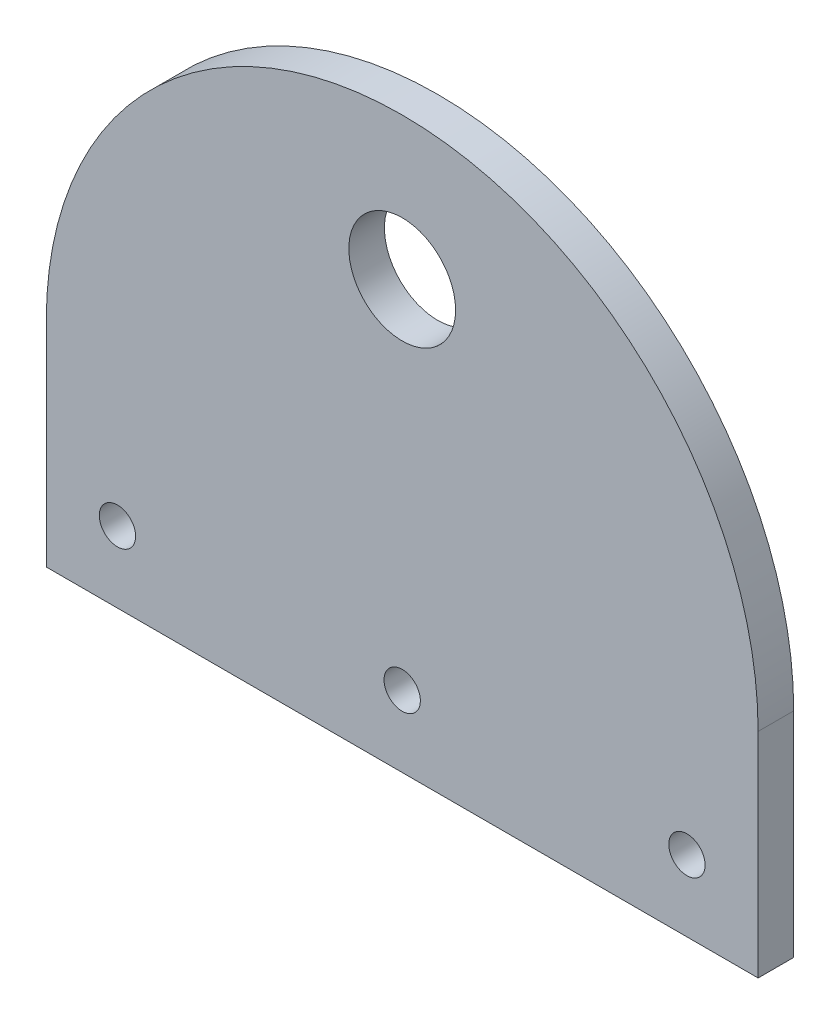
from build123d import *

# Parameters (mm, degrees)
SKETCH_1_R      = 7.5
SKETCH_1_R_2    = 2.55
EXTRUDE_1_DEPTH = 5


with BuildPart() as part:
    # ｽｹｯﾁ1 → ﾎﾞｽ - 押し出し1 (new body)
    with BuildSketch(Plane.XY):
        with BuildLine():
            Line((-50, -60), (50, -60))
            Line((50, -60), (50, -30))
            ThreePointArc((50, -30), (0, 20), (-50, -30))
            Line((-50, -30), (-50, -60))
        make_face()
        Circle(SKETCH_1_R, mode=Mode.SUBTRACT)
        with Locations((-40, -50)):
            Circle(SKETCH_1_R_2, mode=Mode.SUBTRACT)
        with Locations((0, -50)):
            Circle(SKETCH_1_R_2, mode=Mode.SUBTRACT)
        with Locations((40, -50)):
            Circle(SKETCH_1_R_2, mode=Mode.SUBTRACT)
    extrude(amount=EXTRUDE_1_DEPTH)


solid = part.part
